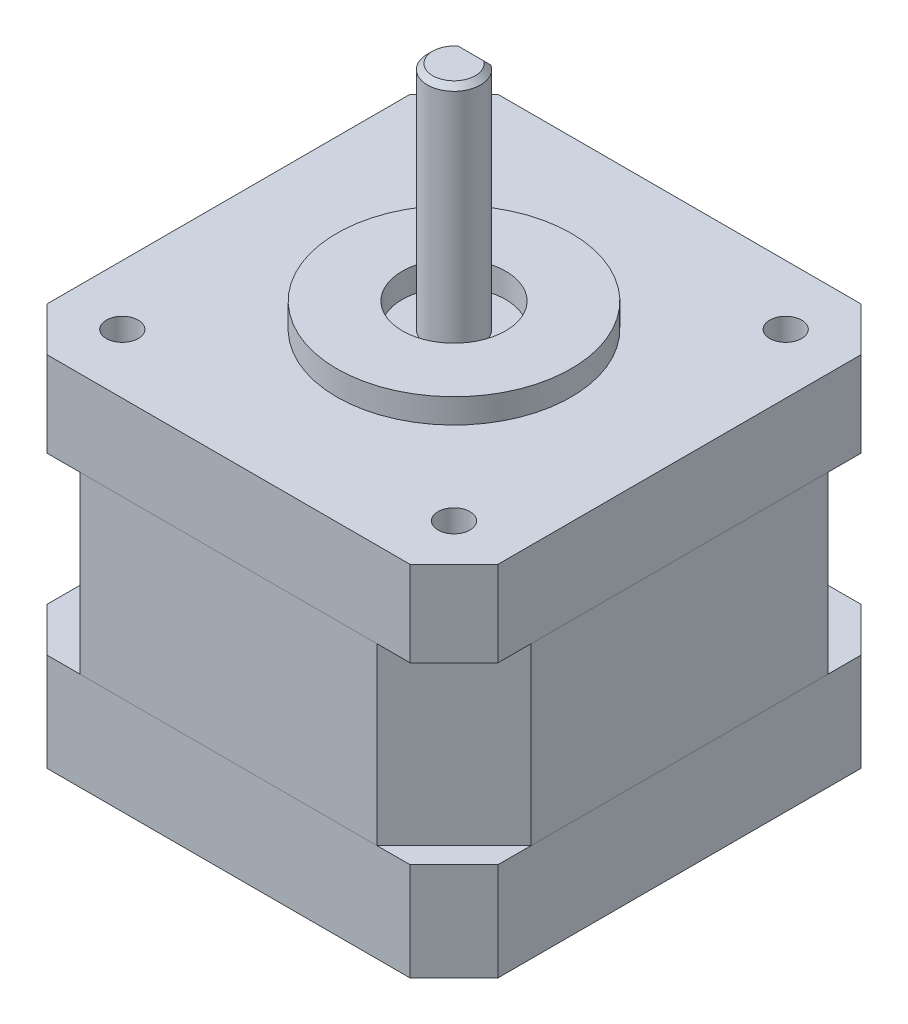
from build123d import *

# Parameters (mm, degrees)
BOTTOMBASE_DEPTH            = 9.2
MIDDLEBASE_DEPTH            = 16.4
TOPBASE_DEPTH               = 8
SKETCH4_R                   = 1.5
MOUNTINGHOLES_DEPTH         = 5
SKETCH5_R                   = 11
RINGAROUNDAXEL_DEPTH        = 2.3
SKETCH6_R                   = 4.85
INNERCUTOUTAROUNDAXEL_DEPTH = 3.6
SKETCH9_W                   = 7.3
SKETCH9_H                   = 6.45
WIRES_2_DEPTH               = 2
SKETCH10_R                  = 2.5
AXEL_DEPTH                  = 21.6
FLATFACEOFAXEL_DEPTH        = 15
CHAMFER1_SIZE               = 0.5


with BuildPart() as part:
    # Sketch1 → BottomBase (new body)
    with BuildSketch(Plane(origin=(0, 0, 0), x_dir=(1, 0, 0), z_dir=(0, 1, 0))):
        Polygon((-17.033766184, 21.15), (-21.15, 17.033766184), (-21.15, -17.033766184), (-17.033766184, -21.15), (17.033766184, -21.15), (21.15, -17.033766184), (21.15, 17.033766184), (17.033766184, 21.15), align=None)
    extrude(amount=BOTTOMBASE_DEPTH)

    # Sketch9 → Wires 2 (cut)
    with BuildSketch(Plane.ZY.offset(21.15)):
        with Locations((0, 5.225)):
            Rectangle(SKETCH9_W, SKETCH9_H)
    extrude(amount=-WIRES_2_DEPTH, mode=Mode.SUBTRACT)


with BuildPart() as body_2:
    # Sketch2 → MiddleBase (new body)
    with BuildSketch(Plane(origin=(0, 9.2, 0), x_dir=(1, 0, 0), z_dir=(0, 1, 0))):
        Polygon((13.922496347, -21.15), (21.15, -13.922496347), (21.15, 13.922496347), (13.922496347, 21.15), (-13.922496347, 21.15), (-21.15, 13.922496347), (-21.15, -13.922496347), (-13.922496347, -21.15), align=None)
    extrude(amount=MIDDLEBASE_DEPTH)


with BuildPart() as body_3:
    # Sketch3 → TopBase (new body)
    with BuildSketch(Plane(origin=(0, 25.6, 0), x_dir=(1, 0, 0), z_dir=(0, 1, 0))):
        Polygon((21.15, 17.033766184), (17.033766184, 21.15), (-17.033766184, 21.15), (-21.15, 17.033766184), (-21.15, -17.033766184), (-17.033766184, -21.15), (17.033766184, -21.15), (21.15, -17.033766184), align=None)
    extrude(amount=TOPBASE_DEPTH)

    # Sketch4 → MountingHoles (cut)
    with BuildSketch(Plane(origin=(0, 33.6, 0), x_dir=(1, 0, 0), z_dir=(0, 1, 0))):
        with Locations(Location((15.556349186, 15.556349186, 0), (0, 0, 270))):
            Circle(SKETCH4_R)
        with Locations(Location((15.556349186, -15.556349186, 0), (0, 0, 270))):
            Circle(SKETCH4_R)
        with Locations(Location((-15.556349186, -15.556349186, 0), (0, 0, 270))):
            Circle(SKETCH4_R)
        with Locations(Location((-15.556349186, 15.556349186, 0), (0, 0, 270))):
            Circle(SKETCH4_R)
    extrude(amount=-MOUNTINGHOLES_DEPTH, mode=Mode.SUBTRACT)



with BuildPart() as body_4:
    # Sketch5 → RingAroundAxel (new body)
    with BuildSketch(Plane(origin=(0, 33.6, 0), x_dir=(1, 0, 0), z_dir=(0, 1, 0))):
        with Locations(Location((0, 0, 0), (0, 0, 270))):
            Circle(SKETCH5_R)
    extrude(amount=RINGAROUNDAXEL_DEPTH)

    # Sketch6 → InnerCutoutAroundAxel (cut)
    with BuildSketch(Plane(origin=(0, 35.9, 0), x_dir=(1, 0, 0), z_dir=(0, 1, 0))):
        with Locations(Location((0, 0, 0), (0, 0, 270))):
            Circle(SKETCH6_R)
    extrude(amount=-INNERCUTOUTAROUNDAXEL_DEPTH, mode=Mode.SUBTRACT)


with BuildPart() as body_3_1:
    add(body_3.part)

    add(body_4.part)  # Axel merges body 4
    # Sketch10 → Axel (add)
    with BuildSketch(Plane(origin=(0, 33.6, 0), x_dir=(1, 0, 0), z_dir=(0, 1, 0))):
        with Locations(Location((0, 0, 0), (0, 0, 90))):
            Circle(SKETCH10_R)
    extrude(amount=AXEL_DEPTH)

    # Sketch11 → FlatFaceOfAxel (cut)
    with BuildSketch(Plane(origin=(0, 55.2, 0), x_dir=(1, 0, 0), z_dir=(0, 1, 0))):
        with BuildLine():
            Line((-1.356465997, 2.1), (1.356465997, 2.1))
            ThreePointArc((1.356465997, 2.1), (0, 2.5), (-1.356465997, 2.1))
        make_face()
    extrude(amount=-FLATFACEOFAXEL_DEPTH, mode=Mode.SUBTRACT)

    # Chamfer1
    # the kernel refuses this chamfer: 0.5 mm, written as the material it takes off along each edge
    with BuildSketch(Plane(origin=(0, 55.2, 0), x_dir=(-0.05693067670621247, 0, -0.9983781337999009), z_dir=(0.9983781337999009, 0, -0.05693067670621247))) as chamfer1_piece_1:
        Polygon((2.5, -CHAMFER1_SIZE), (2.5 - CHAMFER1_SIZE, 0), (2.5, 0), align=None)
    revolve(axis=Axis((0, 55.2, 0), (0, 1, 0)), revolution_arc=353.472695813, mode=Mode.SUBTRACT)
    with BuildSketch(Plane(origin=(-2.642307491, 55.2, -2.1), x_dir=(0, -0.9996219169112968, -0.027495876610586605), z_dir=(1, 0, 0))) as chamfer1_piece_2:
        Polygon((CHAMFER1_SIZE * 0.999621916911, -CHAMFER1_SIZE * 0.0274958766106), (-CHAMFER1_SIZE * 0.0274958766106, -CHAMFER1_SIZE * 0.999621916911), (0, 0), align=None)
    extrude(amount=5.284614981, mode=Mode.SUBTRACT)


solid = Compound([part.part, body_2.part, body_3_1.part])
